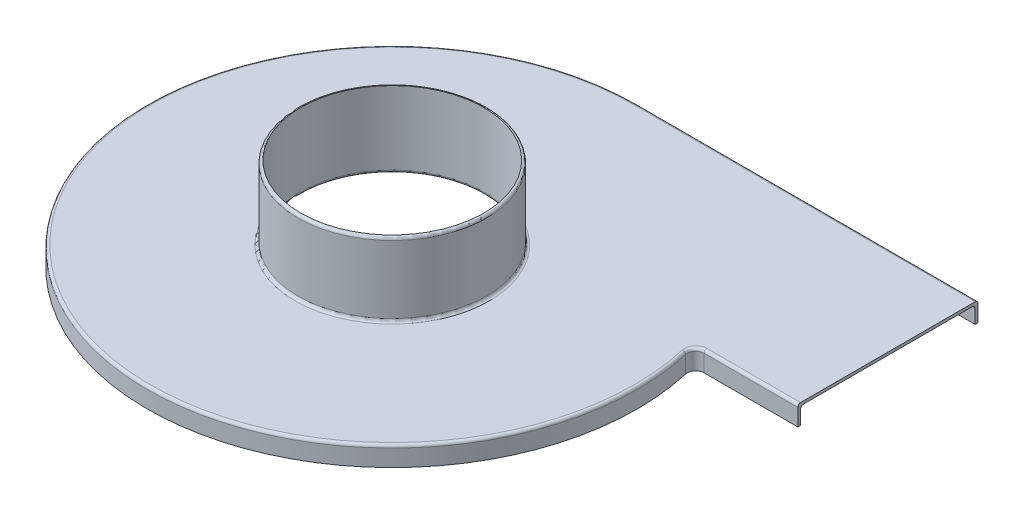
from build123d import *

# Parameters (mm, degrees)
BOSS_EXTRUDE1_DEPTH = 1
BOSS_EXTRUDE2_START = -6
BOSS_EXTRUDE2_DEPTH = 6
SKETCH4_R           = 33.5
SKETCH4_R_2         = 32.5
BOSS_EXTRUDE3_DEPTH = 26
CUT_EXTRUDE3_START  = -1
SKETCH4_4_R         = 32.5
CUT_EXTRUDE3_DEPTH  = 27
FILLET2_R           = 1


with BuildPart() as part:
    # Sketch1 → Boss-Extrude1 (new body)
    with BuildSketch(Plane(origin=(0, 0, 0), x_dir=(1, 0, 0), z_dir=(0, 1, 0))):
        with BuildLine():
            Line((121, 23), (121, 87))
            Line((121, 87), (0, 87))
            ThreePointArc((0, 87), (-54.254032108, -68.011028517), (84.824655745, 19.333333333))
            ThreePointArc((84.824655745, 19.333333333), (85.404435994, 21.870828693), (87.749643874, 23))
            Line((87.749643874, 23), (121, 23))
        make_face()
    extrude(amount=BOSS_EXTRUDE1_DEPTH)

    # Sketch1<3> → Boss-Extrude2 (add)
    with BuildSketch(Plane(origin=(0, 0, 0), x_dir=(1, 0, 0), z_dir=(0, 1, 0)).offset(BOSS_EXTRUDE2_START)):
        with BuildLine():
            Line((121, 23), (121, 24))
            Line((121, 24), (87.749643874, 24))
            ThreePointArc((87.749643874, 24), (84.622700034, 22.494438258), (83.849659702, 19.111111111))
            ThreePointArc((83.849659702, 19.111111111), (-53.630422544, -67.229292557), (0, 86))
            Line((0, 86), (121, 86))
            Line((121, 86), (121, 87))
            Line((121, 87), (0, 87))
            ThreePointArc((0, 87), (-54.254032108, -68.011028517), (84.824655745, 19.333333333))
            ThreePointArc((84.824655745, 19.333333333), (85.404435994, 21.870828693), (87.749643874, 23))
            Line((87.749643874, 23), (121, 23))
        make_face()
    extrude(amount=BOSS_EXTRUDE2_DEPTH)

    # Sketch4 → Boss-Extrude3 (add)
    # profile 1 of 2: a face of its own
    with BuildSketch(Plane(origin=(0, 1, 0), x_dir=(1, 0, 0), z_dir=(0, 1, 0))):
        with Locations(Location((0, 0, 0), (0, 0, 90))):
            Circle(SKETCH4_R)
        Circle(SKETCH4_R_2, mode=Mode.SUBTRACT)
    # profile 2 of 2: a face of its own
    with BuildSketch(Plane(origin=(0, 1, 0), x_dir=(1, 0, 0), z_dir=(0, 1, 0))):
        Circle(SKETCH4_R_2)
    extrude(amount=BOSS_EXTRUDE3_DEPTH)

    # Sketch4<4> → Cut-Extrude3 (cut)
    with BuildSketch(Plane(origin=(0, 1, 0), x_dir=(1, 0, 0), z_dir=(0, 1, 0)).offset(CUT_EXTRUDE3_START)):
        with Locations(Location((0, 0, 0), (0, 0, 270))):
            Circle(SKETCH4_4_R)
    extrude(amount=CUT_EXTRUDE3_DEPTH, mode=Mode.SUBTRACT)

    # Fillet2
    fillet2_edges = [part.edges().sort_by_distance(p)[0] for p in [
        (60.5, 1, -87),
        (-54.254032108, 1, 68.011028517),
        (-53.630422544, 0, 67.229292557),
        (85.404435994, 1, -21.870828693),
        (104.374821937, 0, -24),
        (84.622700034, 0, -22.494438258),
        (60.5, 0, -86),
        (104.374821937, 1, -23),
        (0, 1, 33.5),
        (0, 27, 33.5),
        (0, 0, -32.5),
    ]]
    fillet(fillet2_edges, radius=FILLET2_R - 0.0001)  # a hair under: the kernel refuses the full size


solid = part.part
